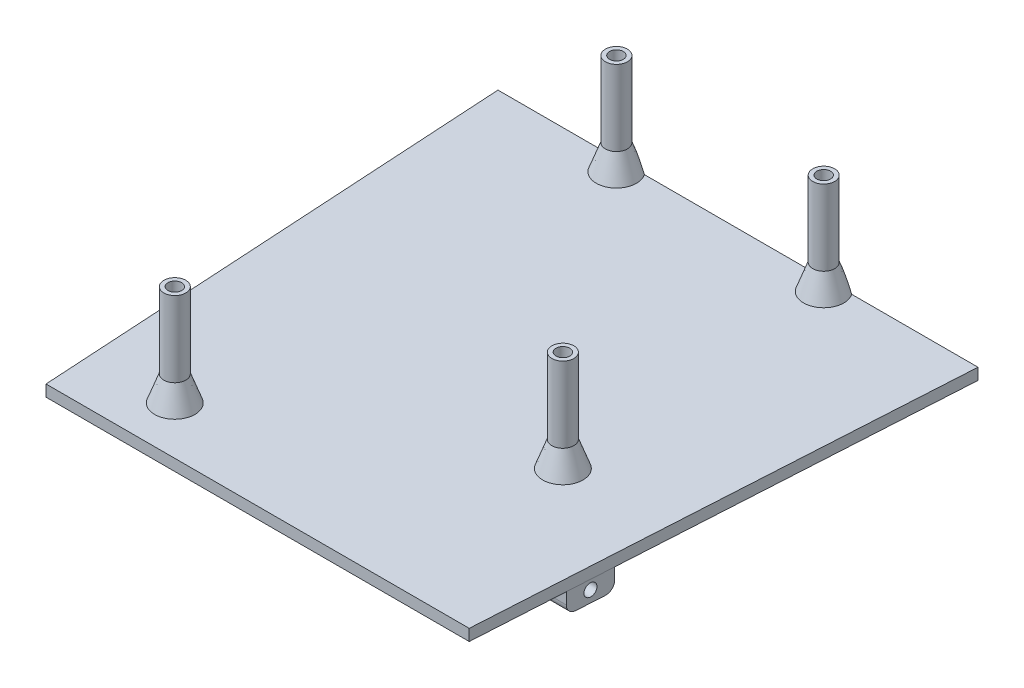
from build123d import *

# Parameters (mm, degrees)
BOSS_EXTRUDE1_START = 40
BOSS_EXTRUDE1_DEPTH = 2.5
SKETCH2_R           = 2.4
BOSS_EXTRUDE2_DEPTH = 22
CUT_EXTRUDE1_START  = 22
SKETCH2_3_R         = 1.5
CUT_EXTRUDE1_DEPTH  = 295.704277162
CHAMFER1_SIZE       = 2
CHAMFER1_SIZE2      = 5.494954839
CHAMFER2_SIZE       = 2
CHAMFER2_SIZE_2     = 5.494954839
SKETCH3_W           = 10
SKETCH3_H           = 5
BOSS_EXTRUDE3_DEPTH = 4.5
FILLET1_R           = 2
CUT_EXTRUDE2_REACH  = 287.714
SKETCH4_R           = 1.35
CUT_EXTRUDE3_REACH  = 293.869
SKETCH5_R           = 1.35
CUT_EXTRUDE4_REACH  = 188.832
SKETCH6_R           = 1.35
CUT_EXTRUDE5_REACH  = 188.762
SKETCH7_R           = 1.35


with BuildPart() as part:
    # Sketch1 → Boss-Extrude1 (new body)
    with BuildSketch(Plane.XZ.offset(-123.724152422).offset(BOSS_EXTRUDE1_START)):
        Polygon((7.812220157, 142.346117951), (14.049843919, 247.346117951), (106.533726398, 247.346117951), (112.70989627, 142.346117951), align=None)
    extrude(amount=BOSS_EXTRUDE1_DEPTH)

    # Sketch2 → Boss-Extrude2 (add)
    with BuildSketch(Plane(origin=(0, 83.724152422, 0), x_dir=(1, 0, 0), z_dir=(0, 1, 0))):
        with Locations(Location((36.196379089, -144.846126643, 0), (0, 0, 90))):
            Circle(SKETCH2_R)
        with Locations(Location((81.496379089, -144.846126643, 0), (0, 0, 90))):
            Circle(SKETCH2_R)
        with Locations(Location((31.696379089, -236.846126643, 0), (0, 0, 90))):
            Circle(SKETCH2_R)
        with Locations(Location((86.496379089, -206.846126643, 0), (0, 0, 90))):
            Circle(SKETCH2_R)
    extrude(amount=BOSS_EXTRUDE2_DEPTH)

    # Sketch2<3> → Cut-Extrude1 (cut, through all)
    with BuildSketch(Plane(origin=(0, 83.724152422, 0), x_dir=(1, 0, 0), z_dir=(0, 1, 0)).offset(CUT_EXTRUDE1_START)):
        with Locations(Location((81.496379089, -144.846126643, 0), (0, 0, 270))):
            Circle(SKETCH2_3_R)
        with Locations(Location((36.196379089, -144.846126643, 0), (0, 0, 270))):
            Circle(SKETCH2_3_R)
        with Locations(Location((86.496379089, -206.846126643, 0), (0, 0, 270))):
            Circle(SKETCH2_3_R)
        with Locations(Location((31.696379089, -236.846126643, 0), (0, 0, 270))):
            Circle(SKETCH2_3_R)
    extrude(amount=-CUT_EXTRUDE1_DEPTH, mode=Mode.SUBTRACT)

    # Chamfer1
    chamfer1_edges = [part.edges().sort_by_distance(p)[0] for p in [
        (86.496379089, 83.724152422, 209.246126643),
        (31.696379089, 83.724152422, 239.246126643),
    ]]
    chamfer1_side = [part.faces().sort_by_distance(p)[0] for p in [
        (60.285277184, 83.724152422, 193.81865211),
    ]]
    chamfer(chamfer1_edges, length=CHAMFER1_SIZE, length2=CHAMFER1_SIZE2, reference=chamfer1_side[0])

    # Chamfer2
    # the kernel refuses this chamfer: 5.494954839, 2 mm, written as the material it adds along each edge
    with BuildSketch(Plane(origin=(36.196379089, 83.724152422, 144.846126643), x_dir=(0, 0, -1), z_dir=(1, 0, 0))) as chamfer2_piece_1_section:
        Polygon((2.4 + CHAMFER2_SIZE, 0), (2.4, CHAMFER2_SIZE_2), (2.4, 0), align=None)
    chamfer2_piece_1 = revolve(axis=Axis((36.196379089, 83.724152422, 144.846126643), (0, 1, 0)), mode=Mode.PRIVATE)
    chamfer2_piece_1 = split(chamfer2_piece_1, bisect_by=Plane(origin=(36.196379089, 86.455650516, 142.346117951), z_dir=(0, 0, 1)), keep=Keep.TOP, mode=Mode.PRIVATE)
    add(chamfer2_piece_1)
    with BuildSketch(Plane(origin=(81.496379089, 83.724152422, 144.846126643), x_dir=(0, 0, -1), z_dir=(1, 0, 0))) as chamfer2_piece_2_section:
        Polygon((2.4 + CHAMFER2_SIZE, 0), (2.4, CHAMFER2_SIZE_2), (2.4, 0), align=None)
    chamfer2_piece_2 = revolve(axis=Axis((81.496379089, 83.724152422, 144.846126643), (0, 1, 0)), mode=Mode.PRIVATE)
    chamfer2_piece_2 = split(chamfer2_piece_2, bisect_by=Plane(origin=(81.496379089, 86.455650516, 142.346117951), z_dir=(0, 0, 1)), keep=Keep.TOP, mode=Mode.PRIVATE)
    add(chamfer2_piece_2)

    # Sketch3 → Boss-Extrude3 (add)
    with BuildSketch(Plane.XZ.offset(-81.224152422)):
        Polygon((12.267665701, 217.346117951), (17.861725107, 217.346117951), (17.861725107, 227.346117951), (12.861725107, 227.346117951), align=None)
        with Locations((25.262521401, 144.846117951)):
            Rectangle(SKETCH3_W, SKETCH3_H)
        Polygon((107.710131584, 227.318361744), (108.298338138, 217.318015768), (102.70427969, 217.321289832), (102.710132441, 227.321288119), align=None)
        Polygon((90.259589888, 142.328560554), (90.262516263, 147.328559698), (100.26251455, 147.322706947), (100.259588175, 142.322707804), align=None)
    extrude(amount=BOSS_EXTRUDE3_DEPTH)

    # Fillet1
    fillet1_edges = [part.edges().sort_by_distance(p)[0] for p in [
        (100.261051363, 76.724152422, 144.822707375),
        (95.262515407, 76.724152422, 147.325633323),
        (90.261053075, 76.724152422, 144.828560126),
        (20.262521401, 76.724152422, 144.846117951),
        (30.262521401, 76.724152422, 144.846117951),
        (25.262521401, 76.724152422, 147.346117951),
        (15.064695404, 76.724152422, 217.346117951),
        (17.861725107, 76.724152422, 222.346117951),
        (15.361725107, 76.724152422, 227.346117951),
        (105.210132013, 76.724152422, 227.319824931),
        (102.707206065, 76.724152422, 222.321288975),
        (105.501308914, 76.724152422, 217.3196528),
    ]]
    fillet(fillet1_edges, radius=FILLET1_R)

    # Sketch4 → Cut-Extrude2 (cut, up to next)
    with BuildSketch(Plane(origin=(120.663233846, 0, 7.097244942), x_dir=(0.05871713825649746, 0, -0.9982746604391837), z_dir=(0.9982746604391838, 0, 0.058717138256497464)), mode=Mode.PRIVATE) as cut_extrude2_sk1:
        with Locations((-215.601729693, 79.224152422)):
            Circle(SKETCH4_R)
    cut_extrude2_tool1 = extrude(cut_extrude2_sk1.sketch, amount=-CUT_EXTRUDE2_REACH, mode=Mode.PRIVATE) & part.part
    add(cut_extrude2_tool1.solids().sort_by_distance((108.003717, 79.224152, 222.326988))[0], mode=Mode.SUBTRACT)

    # Sketch5 → Cut-Extrude3 (cut, up to next)
    with BuildSketch(Plane(origin=(-0.641720197, 0, 0.038121992), x_dir=(0.05930139349204844, 0, 0.9982401237828007), z_dir=(-0.9982401237828007, 0, 0.05930139349204844)), mode=Mode.PRIVATE) as cut_extrude3_sk1:
        with Locations((222.691105358, 79.224152422)):
            Circle(SKETCH5_R)
    cut_extrude3_tool1 = extrude(cut_extrude3_sk1.sketch, amount=-CUT_EXTRUDE3_REACH, mode=Mode.PRIVATE) & part.part
    add(cut_extrude3_tool1.solids().sort_by_distance((12.564173, 79.224152, 222.337319))[0], mode=Mode.SUBTRACT)

    # Sketch6 → Cut-Extrude4 (cut, up to next)
    with BuildSketch(Plane(origin=(0, 0, 142.346117951), x_dir=(-1, 0, 0), z_dir=(0, 0, -1)), mode=Mode.PRIVATE) as cut_extrude4_sk1:
        with Locations((-25.262521401, 79.224152422)):
            Circle(SKETCH6_R)
    cut_extrude4_tool1 = extrude(cut_extrude4_sk1.sketch, amount=-CUT_EXTRUDE4_REACH, mode=Mode.PRIVATE) & part.part
    add(cut_extrude4_tool1.solids().sort_by_distance((25.262521, 79.224152, 142.346118))[0], mode=Mode.SUBTRACT)

    # Sketch7 → Cut-Extrude5 (cut, up to next)
    with BuildSketch(Plane(origin=(0.083332265, 0, 142.381338481), x_dir=(-0.9999998287265196, 0, 0.0005852750905060992), z_dir=(-0.0005852750905060992, 0, -0.9999998287265196)), mode=Mode.PRIVATE) as cut_extrude5_sk1:
        with Locations((-95.176273068, 79.224152422)):
            Circle(SKETCH7_R)
    cut_extrude5_tool1 = extrude(cut_extrude5_sk1.sketch, amount=-CUT_EXTRUDE5_REACH, mode=Mode.PRIVATE) & part.part
    add(cut_extrude5_tool1.solids().sort_by_distance((95.259589, 79.224152, 142.325634))[0], mode=Mode.SUBTRACT)


solid = part.part
